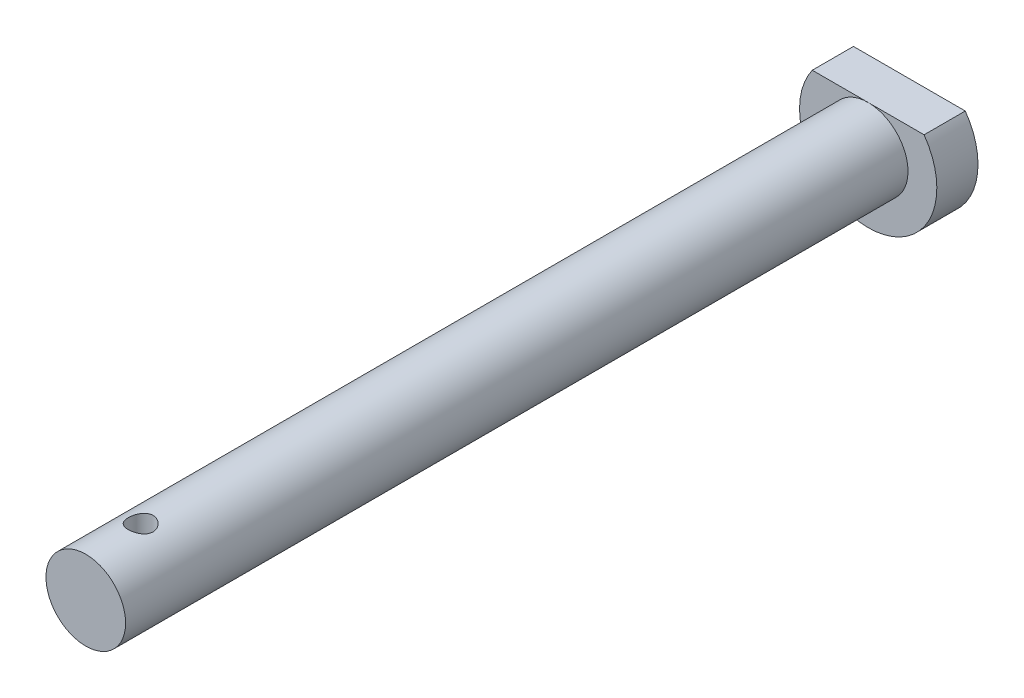
from build123d import *

# Parameters (mm, degrees)
SKETCH1_R            = 2.9
BOSS_EXTRUDE1_DEPTH  = 57
BOSS_EXTRUDE2_START  = -3
SKETCH1_3_R          = 5
SKETCH1_3_R_2        = 2.9
BOSS_EXTRUDE2_DEPTH  = 3
INTERSECT1_START     = 2.9
INTERSECT1_OUTLINE_W = 12
INTERSECT1_OUTLINE_H = 3
INTERSECT1_DEPTH     = 2.1
SKETCH2_R            = 0.9
CUT_EXTRUDE1_DEPTH   = 58.761665488


# Read off the part's stored shape, not the designer's step: Intersect1
with BuildPart() as part:
    # Sketch1 → Boss-Extrude1 (new body)
    with BuildSketch(Plane.XY):
        with Locations(Location((0, 0, 0), (0, 0, 180))):
            Circle(SKETCH1_R)
    extrude(amount=BOSS_EXTRUDE1_DEPTH)

    # Sketch1<3> → Boss-Extrude2 (add)
    # profile 1 of 2: a face of its own
    with BuildSketch(Plane.XY.offset(BOSS_EXTRUDE2_START)):
        Circle(SKETCH1_3_R)
        with Locations(Location((0, 0, 0), (0, 0, 180))):
            Circle(SKETCH1_3_R_2, mode=Mode.SUBTRACT)
    # profile 2 of 2: a face of its own
    with BuildSketch(Plane.XY.offset(BOSS_EXTRUDE2_START)):
        with Locations(Location((0, 0, 0), (0, 0, 180))):
            Circle(SKETCH1_3_R_2)
    extrude(amount=BOSS_EXTRUDE2_DEPTH)

    # Intersect1 outline → Intersect1 (cut)
    with BuildSketch(Plane(origin=(0, 0, 0), x_dir=(1, 0, 0), z_dir=(0, 1, 0)).offset(INTERSECT1_START)):
        with Locations((0, 1.5)):
            Rectangle(INTERSECT1_OUTLINE_W, INTERSECT1_OUTLINE_H)
    extrude(amount=INTERSECT1_DEPTH, mode=Mode.SUBTRACT)

    # Sketch2 → Cut-Extrude1 (cut, through all)
    with BuildSketch(Plane(origin=(0, 2.9, 0), x_dir=(1, 0, 0), z_dir=(0, 1, 0))):
        with Locations(Location((0, -53, 0), (0, 0, 270))):
            Circle(SKETCH2_R)
    extrude(amount=-CUT_EXTRUDE1_DEPTH, mode=Mode.SUBTRACT)


solid = part.part
